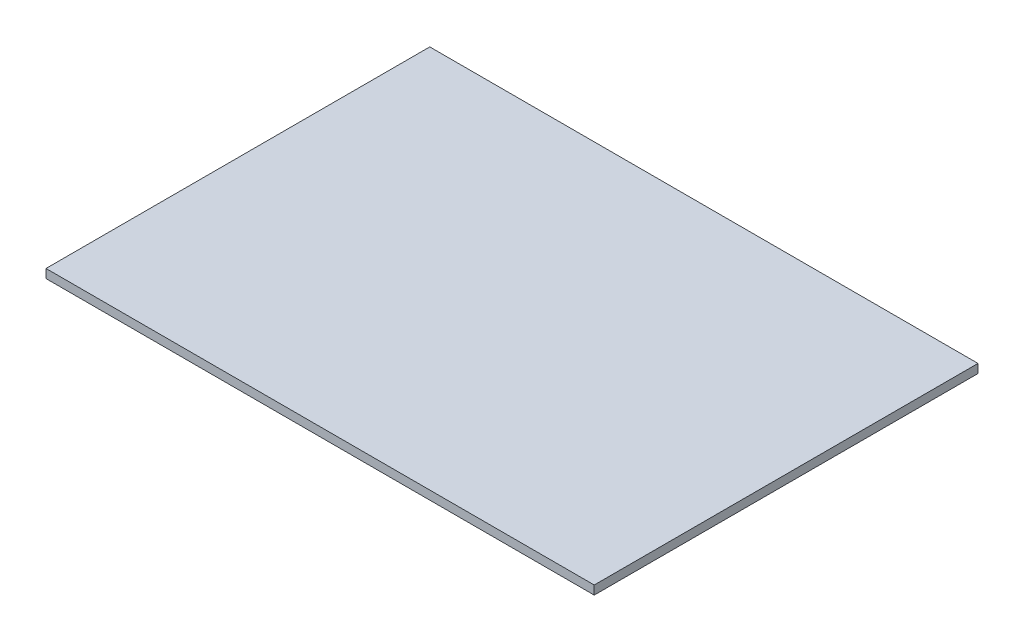
from build123d import *

# Parameters (mm, degrees)
SKETCH2_W           = 100
SKETCH2_H           = 70
BOSS_EXTRUDE1_DEPTH = 1.6


with BuildPart() as part:
    # Sketch2 → Boss-Extrude1 (new body)
    with BuildSketch(Plane(origin=(0, 0, 0), x_dir=(1, 0, 0), z_dir=(0, 1, 0))):
        Rectangle(SKETCH2_W, SKETCH2_H)
    extrude(amount=BOSS_EXTRUDE1_DEPTH)


solid = part.part
